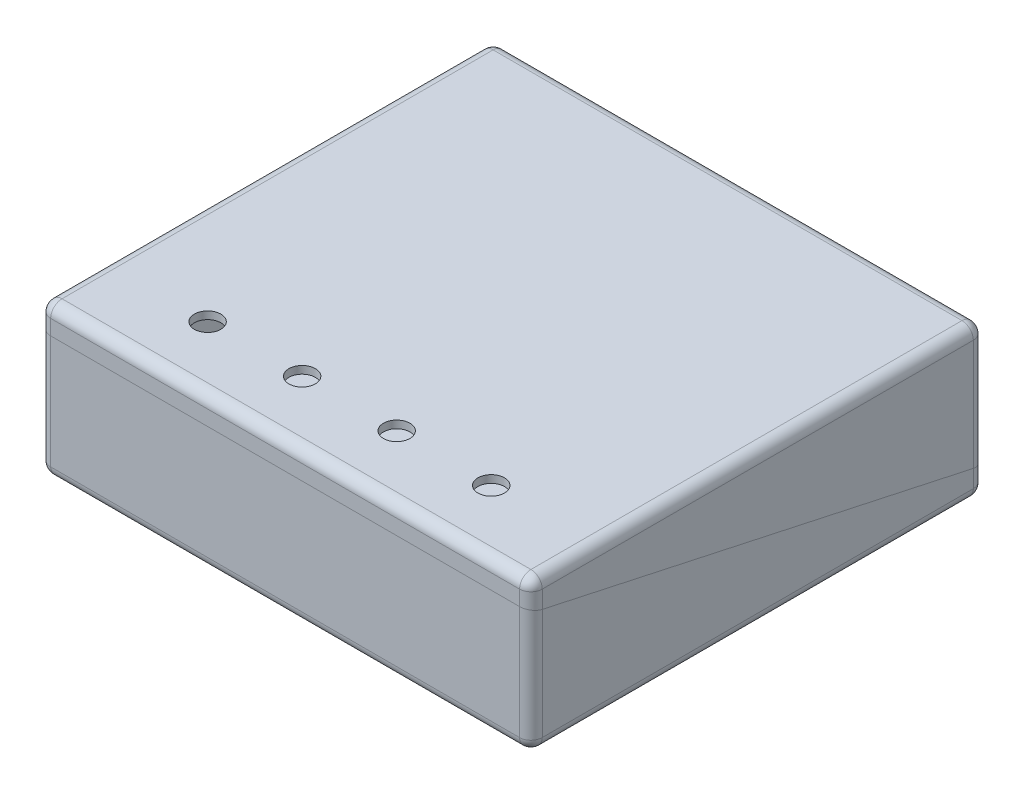
from build123d import *
from OCP.BRepFilletAPI import BRepFilletAPI_MakeFillet

# Parameters (mm, degrees)
SKETCH1_W                      = 130
SKETCH1_H                      = 120
BOSS_EXTRUDE1_DEPTH            = 40
SHELL1_T                       = 2
SKETCH1_7_R                    = 3.5
SKETCH1_7_R_2                  = 1.5
BOSS_EXTRUDE2_DEPTH            = 8
SKETCH2_W                      = 78
SKETCH2_H                      = 22.5
SKETCH2_W_2                    = 74
SKETCH2_H_2                    = 18.5
BOSS_EXTRUDE3_DEPTH            = 20
BOSS_EXTRUDE4_DEPTH            = 8
FILLET1_R                      = 3
CUT_EXTRUDE1_REACH             = 126.916
SKETCH3_W                      = 5
SKETCH3_H                      = 2
CUT_EXTRUDE1_DIRECTION_2_REACH = 126.916
BOSS_EXTRUDE5_START            = 26.2
SKETCH1_9_R                    = 3.5
SKETCH1_9_R_2                  = 1.5
BOSS_EXTRUDE5_DEPTH            = 11.8
SKETCH1_11_R                   = 1.5
CUT_EXTRUDE3_DEPTH             = 8
CHAMFER1_SIZE                  = 3
SKETCH6_R                      = 3.5
CUT_EXTRUDE4_DEPTH             = 8
SKETCH7_R                      = 1.75
CUT_EXTRUDE5_DEPTH             = 8
SPLIT1_SURFACE_1_BACK          = 182.384
SPLIT1_SURFACE_1_DEPTH         = 364.768
SPLIT1_SURFACE_2_BACK          = 182.384
SPLIT1_SURFACE_2_DEPTH         = 364.768
SKETCH9_R                      = 2.75
CUT_EXTRUDE6_DEPTH             = 2
FILLET2_R                      = 2
FILLET2_R_2                    = 1


with BuildPart() as part:
    # Sketch1 → Boss-Extrude1 (new body)
    with BuildSketch(Plane(origin=(0, 0, 0), x_dir=(1, 0, 0), z_dir=(0, 1, 0))):
        Rectangle(SKETCH1_W, SKETCH1_H)
    extrude(amount=BOSS_EXTRUDE1_DEPTH)

    # Shell1 (no face opened: a closed hollow body)
    add(offset(amount=-SHELL1_T, mode=Mode.PRIVATE), mode=Mode.SUBTRACT)

    # Sketch1<7> → Boss-Extrude2 (add)
    # profile 1 of 4: a face of its own
    with BuildSketch(Plane(origin=(0, 0, 0), x_dir=(1, 0, 0), z_dir=(0, 1, 0))):
        with Locations(Location((-39, 7, 0), (0, 0, 90))):
            Circle(SKETCH1_7_R)
        with Locations(Location((-39, 7, 0), (0, 0, 90))):
            Circle(SKETCH1_7_R_2, mode=Mode.SUBTRACT)
    # profile 2 of 4: a face of its own
    with BuildSketch(Plane(origin=(0, 0, 0), x_dir=(1, 0, 0), z_dir=(0, 1, 0))):
        with Locations(Location((-39, 50, 0), (0, 0, 90))):
            Circle(SKETCH1_7_R)
        with Locations(Location((-39, 50, 0), (0, 0, 90))):
            Circle(SKETCH1_7_R_2, mode=Mode.SUBTRACT)
    # profile 3 of 4: a face of its own
    with BuildSketch(Plane(origin=(0, 0, 0), x_dir=(1, 0, 0), z_dir=(0, 1, 0))):
        with Locations(Location((39, 50, 0), (0, 0, 90))):
            Circle(SKETCH1_7_R)
        with Locations(Location((39, 50, 0), (0, 0, 90))):
            Circle(SKETCH1_7_R_2, mode=Mode.SUBTRACT)
    # profile 4 of 4: a face of its own
    with BuildSketch(Plane(origin=(0, 0, 0), x_dir=(1, 0, 0), z_dir=(0, 1, 0))):
        with Locations(Location((39, 7, 0), (0, 0, 90))):
            Circle(SKETCH1_7_R)
        with Locations(Location((39, 7, 0), (0, 0, 90))):
            Circle(SKETCH1_7_R_2, mode=Mode.SUBTRACT)
    extrude(amount=BOSS_EXTRUDE2_DEPTH)

    # Sketch2 → Boss-Extrude3 (add)
    with BuildSketch(Plane(origin=(0, 2, 0), x_dir=(1, 0, 0), z_dir=(0, 1, 0))):
        with Locations((0, -48.75)):
            Rectangle(SKETCH2_W, SKETCH2_H)
        with Locations((0, -48.75)):
            Rectangle(SKETCH2_W_2, SKETCH2_H_2, mode=Mode.SUBTRACT)
    extrude(amount=BOSS_EXTRUDE3_DEPTH)

    # Sketch4 → Boss-Extrude4 (add)
    with BuildSketch(Plane(origin=(0, 2, 0), x_dir=(1, 0, 0), z_dir=(0, 1, 0))):
        Polygon((37, -45.25), (36, -45.25), (36, -46.25), (35, -46.25), (35, -44.25), (37, -44.25), align=None)
        Polygon((37, -52.25), (36, -52.25), (36, -51.25), (35, -51.25), (35, -53.25), (37, -53.25), align=None)
    boss_extrude4 = extrude(amount=BOSS_EXTRUDE4_DEPTH)

    # Fillet1
    fillet1_edges = [part.edges().sort_by_distance(p)[0] for p in [
        (0, 40, 60),
        (-65, 40, 0),
        (0, 40, -60),
        (-65, 0, 0),
        (0, 0, 60),
        (65, 0, 0),
        (0, 0, -60),
        (65, 40, 0),
        (-65, 20, -60),
        (-65, 20, 60),
        (65, 20, 60),
        (65, 20, -60),
    ]]
    fillet(fillet1_edges, radius=FILLET1_R)

    # Sketch3 → Cut-Extrude1 (cut, up to next)
    with BuildSketch(Plane.ZY.offset(-37), mode=Mode.PRIVATE) as cut_extrude1_sk1:
        with Locations((48.75, 3)):
            Rectangle(SKETCH3_W, SKETCH3_H)
    cut_extrude1_tool1 = extrude(cut_extrude1_sk1.sketch, amount=-CUT_EXTRUDE1_REACH, mode=Mode.PRIVATE) & part.part
    add(cut_extrude1_tool1.solids().sort_by_distance((37, 3, 48.75))[0], mode=Mode.SUBTRACT)

    # Sketch3 → Cut-Extrude1 direction 2 (cut, up to next)
    with BuildSketch(Plane.ZY.offset(-37), mode=Mode.PRIVATE) as cut_extrude1_direction_2_sk1:
        with Locations((48.75, 3)):
            Rectangle(SKETCH3_W, SKETCH3_H)
    cut_extrude1_direction_2_tool1 = extrude(cut_extrude1_direction_2_sk1.sketch, amount=CUT_EXTRUDE1_DIRECTION_2_REACH, mode=Mode.PRIVATE) & part.part
    add(cut_extrude1_direction_2_tool1.solids().sort_by_distance((37, 3, 48.75))[0], mode=Mode.SUBTRACT)

    # Mirror1: Boss-Extrude4 across plane
    add(boss_extrude4.mirror(Plane(origin=(0, 0, 0), x_dir=(0, 0, 1), z_dir=(1, 0, 0))))

    # Sketch1<9> → Boss-Extrude5 (add)
    # profile 1 of 4: a face of its own
    with BuildSketch(Plane(origin=(0, 0, 0), x_dir=(1, 0, 0), z_dir=(0, 1, 0)).offset(BOSS_EXTRUDE5_START)):
        with Locations(Location((-39, 50, 0), (0, 0, 90))):
            Circle(SKETCH1_9_R)
        with Locations(Location((-39, 50, 0), (0, 0, 90))):
            Circle(SKETCH1_9_R_2, mode=Mode.SUBTRACT)
    # profile 2 of 4: a face of its own
    with BuildSketch(Plane(origin=(0, 0, 0), x_dir=(1, 0, 0), z_dir=(0, 1, 0)).offset(BOSS_EXTRUDE5_START)):
        with Locations(Location((-39, 7, 0), (0, 0, 90))):
            Circle(SKETCH1_9_R)
        with Locations(Location((-39, 7, 0), (0, 0, 90))):
            Circle(SKETCH1_9_R_2, mode=Mode.SUBTRACT)
    # profile 3 of 4: a face of its own
    with BuildSketch(Plane(origin=(0, 0, 0), x_dir=(1, 0, 0), z_dir=(0, 1, 0)).offset(BOSS_EXTRUDE5_START)):
        with Locations(Location((39, 50, 0), (0, 0, 90))):
            Circle(SKETCH1_9_R)
        with Locations(Location((39, 50, 0), (0, 0, 90))):
            Circle(SKETCH1_9_R_2, mode=Mode.SUBTRACT)
    # profile 4 of 4: a face of its own
    with BuildSketch(Plane(origin=(0, 0, 0), x_dir=(1, 0, 0), z_dir=(0, 1, 0)).offset(BOSS_EXTRUDE5_START)):
        with Locations(Location((39, 7, 0), (0, 0, 90))):
            Circle(SKETCH1_9_R)
        with Locations(Location((39, 7, 0), (0, 0, 90))):
            Circle(SKETCH1_9_R_2, mode=Mode.SUBTRACT)
    extrude(amount=BOSS_EXTRUDE5_DEPTH)

    # Sketch1<11> → Cut-Extrude3 (cut)
    with BuildSketch(Plane(origin=(0, 0, 0), x_dir=(1, 0, 0), z_dir=(0, 1, 0))):
        with Locations(Location((39, 50, 0), (0, 0, 270))):
            Circle(SKETCH1_11_R)
        with Locations(Location((-39, 7, 0), (0, 0, 270))):
            Circle(SKETCH1_11_R)
        with Locations(Location((-39, 50, 0), (0, 0, 270))):
            Circle(SKETCH1_11_R)
        with Locations(Location((39, 7, 0), (0, 0, 270))):
            Circle(SKETCH1_11_R)
    extrude(amount=CUT_EXTRUDE3_DEPTH, mode=Mode.SUBTRACT)

    # Chamfer1
    chamfer1_edges = [part.edges().sort_by_distance(p)[0] for p in [
        (39, 0, -8.5),
        (-39, 0, -51.5),
        (-39, 0, -8.5),
        (39, 0, -51.5),
    ]]
    chamfer(chamfer1_edges, length=CHAMFER1_SIZE)

    # Sketch6 → Cut-Extrude4 (cut)
    with BuildSketch(Plane(origin=(0, 40, 0), x_dir=(1, 0, 0), z_dir=(0, 1, 0))):
        with Locations(Location((-37.5, -43, 0), (0, 0, 270))):
            Circle(SKETCH6_R)
        with Locations(Location((-12.5, -43, 0), (0, 0, 270))):
            Circle(SKETCH6_R)
        with Locations(Location((12.5, -43, 0), (0, 0, 270))):
            Circle(SKETCH6_R)
        with Locations(Location((37.5, -43, 0), (0, 0, 270))):
            Circle(SKETCH6_R)
    extrude(amount=-CUT_EXTRUDE4_DEPTH, mode=Mode.SUBTRACT)

    # Sketch7 → Cut-Extrude5 (cut)
    with BuildSketch(Plane.ZY.offset(65)):
        with Locations((37.811189131, 19.94834537)):
            Circle(SKETCH7_R)
    extrude(amount=-CUT_EXTRUDE5_DEPTH, mode=Mode.SUBTRACT)


with BuildPart() as body_2:
    # Split1: the piece behind the surface
    add(part.part)
    # Split1 surface: a surface, the sketch's curves swept straight by 364.768 mm
    with BuildLine(Plane(origin=(0, 0, 0), x_dir=(0, 0, -1), z_dir=(1, 0, 0)).offset(-SPLIT1_SURFACE_1_BACK), mode=Mode.PRIVATE) as split1_surface_1_path:
        Line((60, 7), (-60, 33))
    split1_surface_1 = Shell.extrude(split1_surface_1_path.wire(), (1 * SPLIT1_SURFACE_1_DEPTH, 0 * SPLIT1_SURFACE_1_DEPTH, 0 * SPLIT1_SURFACE_1_DEPTH))
    split(bisect_by=split1_surface_1, keep=Keep.BOTTOM)

    # Sketch9 → Cut-Extrude6 (cut)
    with BuildSketch(Plane(origin=(0, 0, -60), x_dir=(-1, 0, 0), z_dir=(0, 0, -1))):
        with Locations((-24.25, 12.09)):
            Circle(SKETCH9_R)
        with Locations((-3.5, 12.09)):
            Circle(SKETCH9_R)
        with Locations((25.45, 12.09)):
            Circle(SKETCH9_R)
        with BuildLine():
            Line((-25.260000016, 25.949999999), (-31.739999982, 25.949999999))
            ThreePointArc((-31.739999982, 25.949999999), (-33.539999982, 27.749999999), (-31.739999982, 29.549999999))
            Line((-31.739999982, 29.549999999), (-25.260000016, 29.549999999))
            ThreePointArc((-25.260000016, 29.549999999), (-23.460000016, 27.749999999), (-25.260000016, 25.949999999))
        make_face()
    extrude(amount=-CUT_EXTRUDE6_DEPTH, mode=Mode.SUBTRACT)

    # Fillet2
    fillet2_edges_1 = [body_2.edges().sort_by_distance(p)[0] for p in [
        (28.499999999, 25.949999999, -60),
    ]]
    fillet2_edges_2 = [body_2.edges().sort_by_distance(p)[0] for p in [
        (27, 12.09, -60),
        (6.25, 12.09, -60),
        (-22.7, 12.09, -60),
        (6.25, 12.09, -58),
        (27, 12.09, -58),
        (-22.7, 12.09, -58),
    ]]
    fillet2 = BRepFilletAPI_MakeFillet(body_2.part.solid().wrapped)
    for e in fillet2_edges_1:
        fillet2.Add(FILLET2_R - 0.0001, e.wrapped)
    for e in fillet2_edges_2:
        fillet2.Add(FILLET2_R_2 - 0.0001, e.wrapped)
    add(Compound.cast(fillet2.Shape()), mode=Mode.REPLACE)  # a hair under: the kernel refuses the full size


with BuildPart() as part_1:
    add(part.part)

    # Split1: split by a surface, the side it looks to stays
    # Split1 surface: a surface, the sketch's curves swept straight by 364.768 mm
    with BuildLine(Plane(origin=(0, 0, 0), x_dir=(0, 0, -1), z_dir=(1, 0, 0)).offset(-SPLIT1_SURFACE_2_BACK), mode=Mode.PRIVATE) as split1_surface_2_path:
        Line((60, 7), (-60, 33))
    split1_surface_2 = Shell.extrude(split1_surface_2_path.wire(), (1 * SPLIT1_SURFACE_2_DEPTH, 0 * SPLIT1_SURFACE_2_DEPTH, 0 * SPLIT1_SURFACE_2_DEPTH))
    split(bisect_by=split1_surface_2, keep=Keep.TOP)


solid = Compound([body_2.part, part_1.part])
